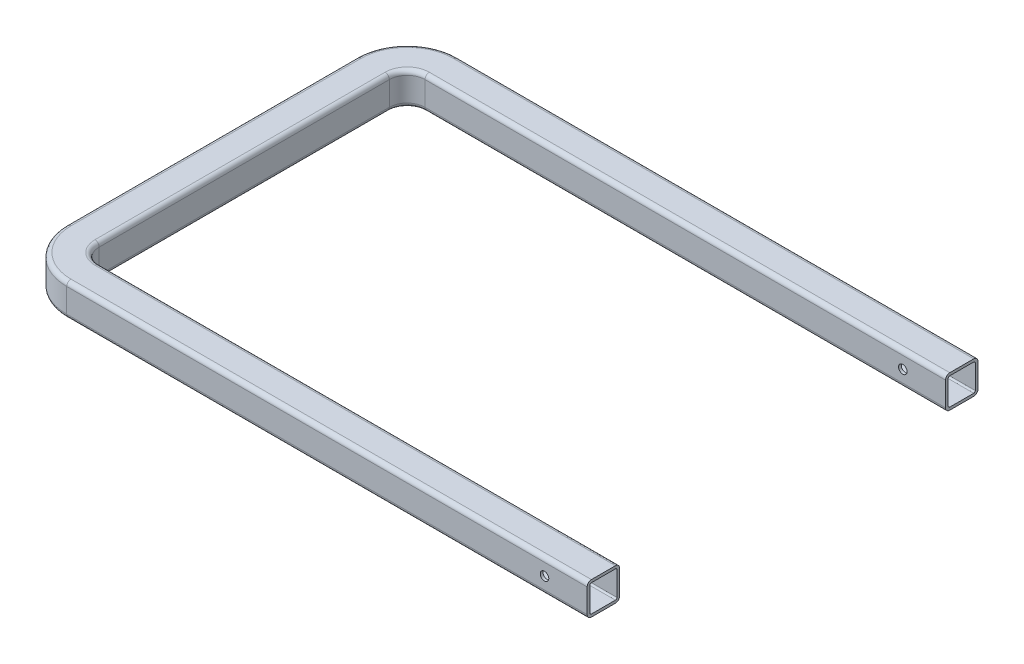
from build123d import *

# Parameters (mm, degrees)
CUT_EXTRUDE1_DEPTH      = 801.472177983
CUT_EXTRUDE1_DEPTH_BACK = 801.472177983
SKETCH3_R               = 5


with BuildPart() as part:
    # Sweep-Thin1: sweep along a path in Sketch1
    with BuildLine(Plane(origin=(0, 0, 0), x_dir=(1, 0, 0), z_dir=(0, 1, 0))) as sweep_thin1_path:
        Line((0, 0), (-610, 0))
        ThreePointArc((-610, 0), (-638.284271247, 11.715728753), (-650, 40))
        Line((-650, 40), (-650, 380))
        ThreePointArc((-650, 380), (-638.284271247, 408.284271247), (-610, 420))
        Line((-610, 420), (0, 420))
    # Sketch2 → Sweep-Thin1 (sweep)
    with BuildSketch(Plane(origin=(0, 0, 0), x_dir=(0, 0, -1), z_dir=(1, 0, 0))):
        with BuildLine():
            Line((14.05, 19.05), (-14.05, 19.05))
            ThreePointArc((-14.05, 19.05), (-17.585533906, 17.585533906), (-19.05, 14.05))
            Line((-19.05, 14.05), (-19.05, -14.05))
            ThreePointArc((-19.05, -14.05), (-17.585533906, -17.585533906), (-14.05, -19.05))
            Line((-14.05, -19.05), (14.05, -19.05))
            ThreePointArc((14.05, -19.05), (17.585533906, -17.585533906), (19.05, -14.05))
            Line((19.05, -14.05), (19.05, 14.05))
            ThreePointArc((19.05, 14.05), (17.585533906, 17.585533906), (14.05, 19.05))
        make_face()
        with BuildLine():
            Line((14.05, 15.875), (-14.05, 15.875))
            ThreePointArc((-14.05, 15.875), (-15.340469876, 15.340469876), (-15.875, 14.05))
            Line((-15.875, 14.05), (-15.875, -14.05))
            ThreePointArc((-15.875, -14.05), (-15.340469876, -15.340469876), (-14.05, -15.875))
            Line((-14.05, -15.875), (14.05, -15.875))
            ThreePointArc((14.05, -15.875), (15.340469876, -15.340469876), (15.875, -14.05))
            Line((15.875, -14.05), (15.875, 14.05))
            ThreePointArc((15.875, 14.05), (15.340469876, 15.340469876), (14.05, 15.875))
        make_face(mode=Mode.SUBTRACT)
    sweep(path=sweep_thin1_path.line)

    # Sketch3 → Cut-Extrude1 (cut, two sides: drawn at the far end of the back side and taken through both)
    with BuildSketch(Plane.XY.offset(-CUT_EXTRUDE1_DEPTH_BACK)):
        with Locations((-50, 0)):
            Circle(SKETCH3_R)
    extrude(amount=CUT_EXTRUDE1_DEPTH + CUT_EXTRUDE1_DEPTH_BACK, mode=Mode.SUBTRACT)


solid = part.part
